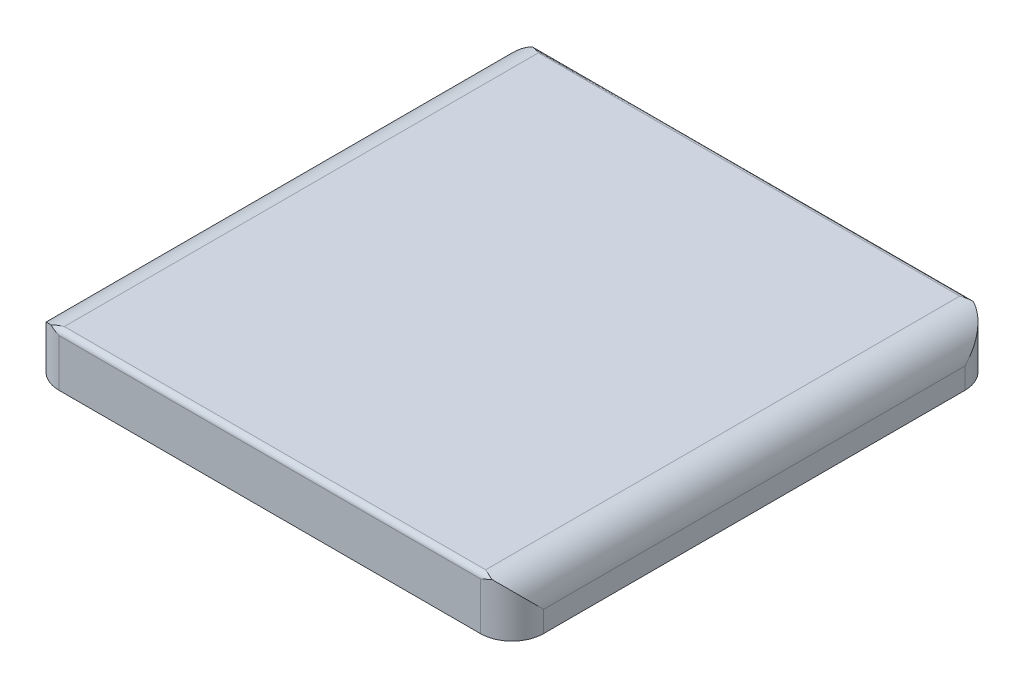
from build123d import *

# Parameters (mm, degrees)
BOSS_EXTRUDE1_DEPTH = 12.7
FILLET1_R           = 7.62
FILLET3_R           = 1.27
SHELL1_T            = -1.778


with BuildPart() as part:
    # Sketch2 → Boss-Extrude1 (new body)
    with BuildSketch(Plane(origin=(0, 0, 0), x_dir=(1, 0, 0), z_dir=(0, 1, 0))):
        with BuildLine():
            Line((-50.8, -58.42), (50.8, -58.42))
            ThreePointArc((50.8, -58.42), (56.188153673, -56.188153673), (58.42, -50.8))
            Line((58.42, -50.8), (58.42, 50.8))
            ThreePointArc((58.42, 50.8), (56.188153673, 56.188153673), (50.8, 58.42))
            Line((50.8, 58.42), (-50.8, 58.42))
            ThreePointArc((-50.8, 58.42), (-56.188153673, 56.188153673), (-58.42, 50.8))
            Line((-58.42, 50.8), (-58.42, -50.8))
            ThreePointArc((-58.42, -50.8), (-56.188153673, -56.188153673), (-50.8, -58.42))
        make_face()
    extrude(amount=BOSS_EXTRUDE1_DEPTH)

    # Fillet1
    # the kernel refuses this fillet: 7.62 mm, written as the material it takes off along each edge
    with BuildSketch(Plane(origin=(58.42, 12.7, 69.85), x_dir=(0, -1, 0), z_dir=(0, 0, -1)), Plane(origin=(-58.42, 12.7, -69.85), x_dir=(0, -1, 0), z_dir=(0, 0, 1))) as fillet1_piece_1:
        with BuildLine():
            CenterArc((FILLET1_R, FILLET1_R), FILLET1_R, 180, 90)
            Line((0, FILLET1_R), (0, 0))
            Line((0, 0), (FILLET1_R, 0))
        make_face()
    extrude(amount=139.7, mode=Mode.SUBTRACT)

    # Fillet3
    # the kernel refuses this fillet: 1.27 mm, written as the material it takes off along each edge
    with BuildSketch(Plane(origin=(53.975, 12.7, -58.42), x_dir=(0, 0, 1), z_dir=(-1, 0, 0))) as fillet3_piece_1:
        with BuildLine():
            CenterArc((FILLET3_R, -FILLET3_R), FILLET3_R, 90, 90)
            Line((0, -FILLET3_R), (0, 0))
            Line((0, 0), (FILLET3_R, 0))
        make_face()
    extrude(amount=107.95, mode=Mode.SUBTRACT)
    with BuildSketch(Plane(origin=(-53.975, 12.7, 58.42), x_dir=(0, -1, 0), z_dir=(1, 0, 0))) as fillet3_piece_2:
        with BuildLine():
            CenterArc((FILLET3_R, FILLET3_R), FILLET3_R, 180, 90)
            Line((0, FILLET3_R), (0, 0))
            Line((0, 0), (FILLET3_R, 0))
        make_face()
    extrude(amount=107.95, mode=Mode.SUBTRACT)

    # Shell1
    shell1_openings = [part.faces().sort_by_distance(p)[0] for p in [
        (0, 0, 0),
    ]]
    offset(amount=SHELL1_T, openings=shell1_openings)


solid = part.part
